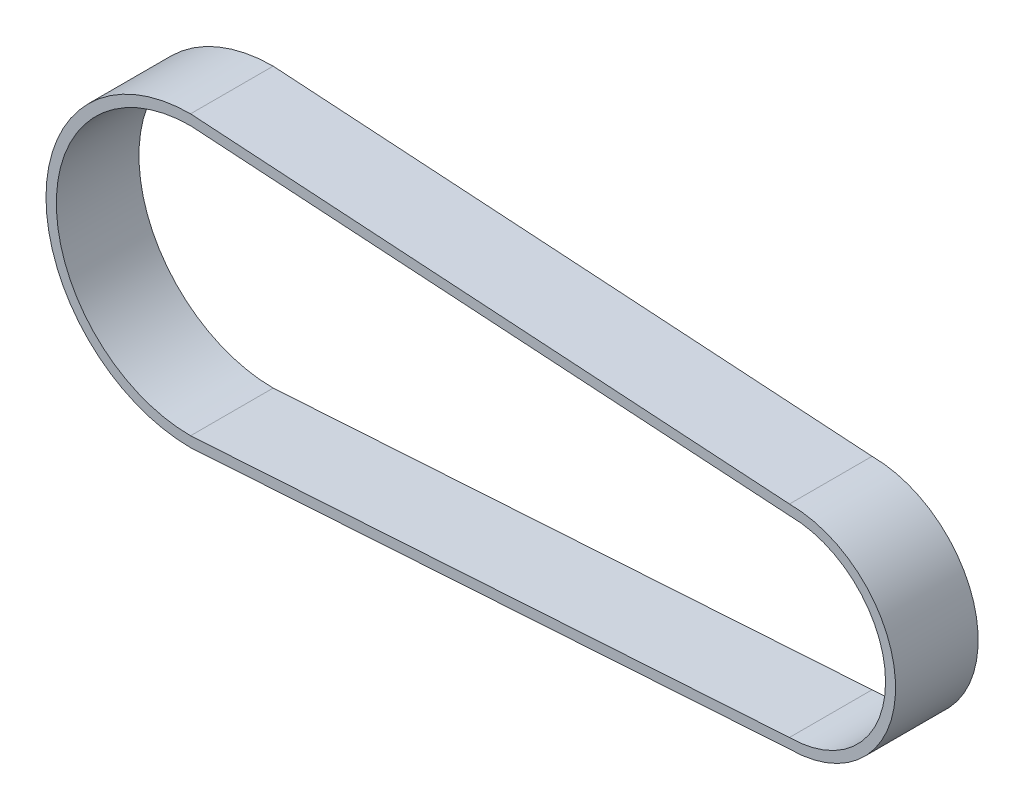
from build123d import *

# Parameters (mm, degrees)
BOSS_EXTRU_1_DEPTH = 8


with BuildPart() as part:
    # Esquisse1 → Boss.-Extru.1 (new body)
    with BuildSketch(Plane.XY):
        with BuildLine():
            Line((-33, -14), (25, -10.276071075))
            ThreePointArc((25, -10.276071075), (35.276071075, 0), (25, 10.276071075))
            Line((25, 10.276071075), (-33, 14))
            ThreePointArc((-33, 14), (-47, 0), (-33, -14))
        make_face()
        with BuildLine():
            Line((-33, 13), (25, 9.305785122))
            ThreePointArc((25, 9.305785122), (34.305785122, 0), (25, -9.305785122))
            Line((25, -9.305785122), (-33, -13))
            ThreePointArc((-33, -13), (-46, 0), (-33, 13))
        make_face(mode=Mode.SUBTRACT)
    extrude(amount=BOSS_EXTRU_1_DEPTH)


solid = part.part
